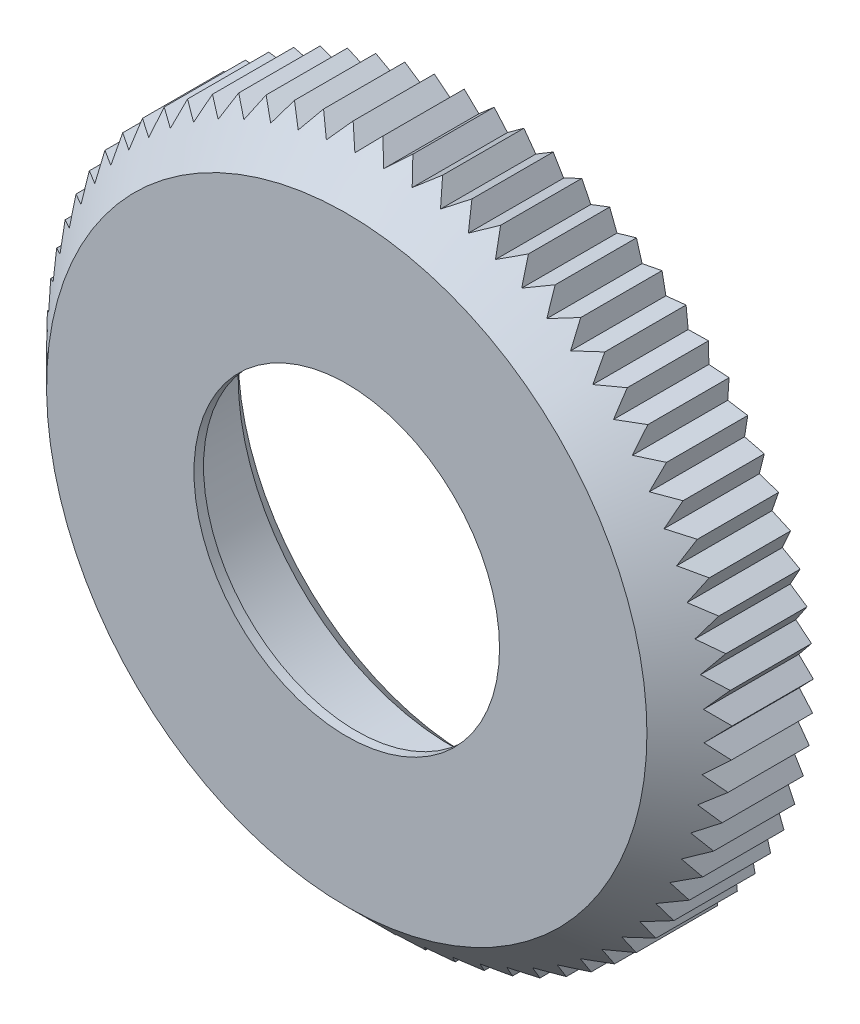
from build123d import *

# Parameters (mm, degrees)
ESQUISSE1_R                  = 17.25
ESQUISSE1_R_2                = 8.016386033
BOSS_EXTRU_1_DEPTH           = 0.5
BOSS_EXTRU_2_START           = 6
ESQUISSE2_R                  = 17.25
ESQUISSE2_R_2                = 11.2
BOSS_EXTRU_2_DEPTH           = 6
CHANFREIN1_SIZE              = 1
CHANFREIN2_SIZE              = 1.5
BOSS_EXTRU_3_REACH           = 27.246
R_P_TITION_CIRCULAIRE1_COUNT = 72


with BuildPart() as part:
    # Esquisse1 → Boss.-Extru.1 (new body)
    with BuildSketch(Plane.XY):
        Circle(ESQUISSE1_R)
        Circle(ESQUISSE1_R_2, mode=Mode.SUBTRACT)
    extrude(amount=BOSS_EXTRU_1_DEPTH)

    # Esquisse2 → Boss.-Extru.2 (add)
    with BuildSketch(Plane(origin=(0, 0, 0), x_dir=(-1, 0, 0), z_dir=(0, 0, -1)).offset(BOSS_EXTRU_2_START)):
        Circle(ESQUISSE2_R)
        Circle(ESQUISSE2_R_2, mode=Mode.SUBTRACT)
    extrude(amount=-BOSS_EXTRU_2_DEPTH)

    # Chanfrein1
    chanfrein1_edges = [part.edges().sort_by_distance(p)[0] for p in [
        (11.2, 0, -6),
    ]]
    chamfer(chanfrein1_edges, length=CHANFREIN1_SIZE)

    # Chanfrein2
    chanfrein2_edges = [part.edges().sort_by_distance(p)[0] for p in [
        (-17.25, 0, 0.5),
    ]]
    chamfer(chanfrein2_edges, length=CHANFREIN2_SIZE)

    # Boss.-Extru.3: up to this cone (the profile starts inside it)
    boss_extru_3_end = Plane(origin=(0, 0, -6), z_dir=(0, 0, -1)).offset(-22.249999) * Cone(1e-06, 72.246, 72.245999, align=(Align.CENTER, Align.CENTER, Align.MIN), mode=Mode.PRIVATE)
    # Esquisse3 → Boss.-Extru.3 (add, up to the surface)
    with BuildSketch(Plane(origin=(0, 0, -6), x_dir=(-1, 0, 0), z_dir=(0, 0, -1)), mode=Mode.PRIVATE) as boss_extru_3_sk1:
        with BuildLine():
            Line((-1.233490455, 17.943669692), (-1.932550994, 17.141404454))
            ThreePointArc((-1.932550994, 17.141404454), (-1.183014073, 17.209386326), (-0.431225217, 17.244609152))
            Line((-0.431225217, 17.244609152), (-1.233490455, 17.943669692))
        make_face()
    boss_extru_3_tool1 = extrude(boss_extru_3_sk1.sketch, amount=-BOSS_EXTRU_3_REACH, mode=Mode.PRIVATE) & boss_extru_3_end
    boss_extru_3 = boss_extru_3_tool1.solids().sort_by_distance((1.199591, 17.45053, -6))[0]
    add(boss_extru_3)

    # Répétition circulaire1: Boss.-Extru.3 ×72 about axis
    r_p_tition_circulaire1_axis = Axis((0, 0, 0.5), (0, 0, -1))
    for i in range(1, R_P_TITION_CIRCULAIRE1_COUNT):
        add(boss_extru_3.rotate(r_p_tition_circulaire1_axis, i * 360 / R_P_TITION_CIRCULAIRE1_COUNT))


solid = part.part
